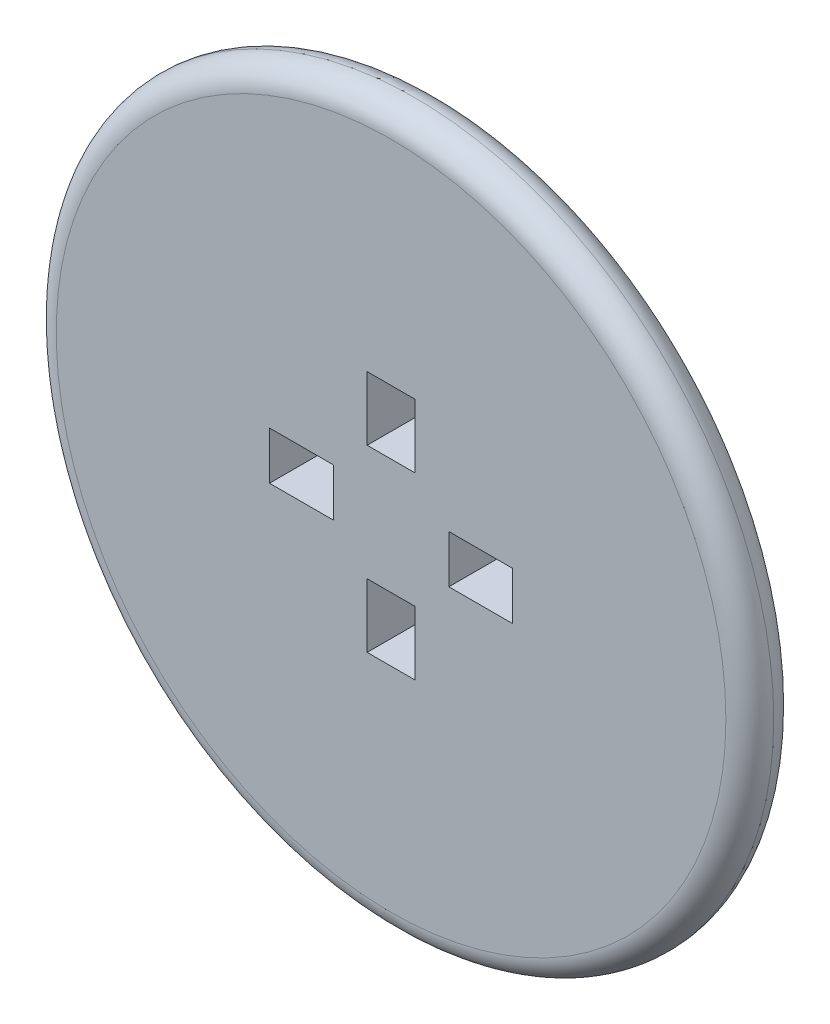
from build123d import *

# Parameters (mm, degrees)
SKETCH1_R           = 45
SKETCH1_W           = 8
SKETCH1_H           = 6
SKETCH1_W_2         = 6
SKETCH1_H_2         = 8
BOSS_EXTRUDE1_DEPTH = 6
FILLET1_R           = 3
FILLET2_R           = 3


with BuildPart() as part:
    # Sketch1 → Boss-Extrude1 (new body)
    with BuildSketch(Plane.XY):
        Circle(SKETCH1_R)
        with Locations((11.25, 0)):
            Rectangle(SKETCH1_W, SKETCH1_H, mode=Mode.SUBTRACT)
        with Locations((0, -11.25)):
            Rectangle(SKETCH1_W_2, SKETCH1_H_2, mode=Mode.SUBTRACT)
        with Locations((-11.25, 0)):
            Rectangle(SKETCH1_W, SKETCH1_H, mode=Mode.SUBTRACT)
        with Locations((0, 11.25)):
            Rectangle(SKETCH1_W_2, SKETCH1_H_2, mode=Mode.SUBTRACT)
    extrude(amount=BOSS_EXTRUDE1_DEPTH)

    # Fillet1
    fillet1_edges = [part.edges().sort_by_distance(p)[0] for p in [
        (-45, 0, 6),
    ]]
    fillet(fillet1_edges, radius=FILLET1_R)

    # Fillet2
    fillet2_edges = [part.edges().sort_by_distance(p)[0] for p in [
        (-45, 0, 0),
    ]]
    fillet(fillet2_edges, radius=FILLET2_R - 0.0001)  # a hair under: the kernel refuses the full size


solid = part.part
